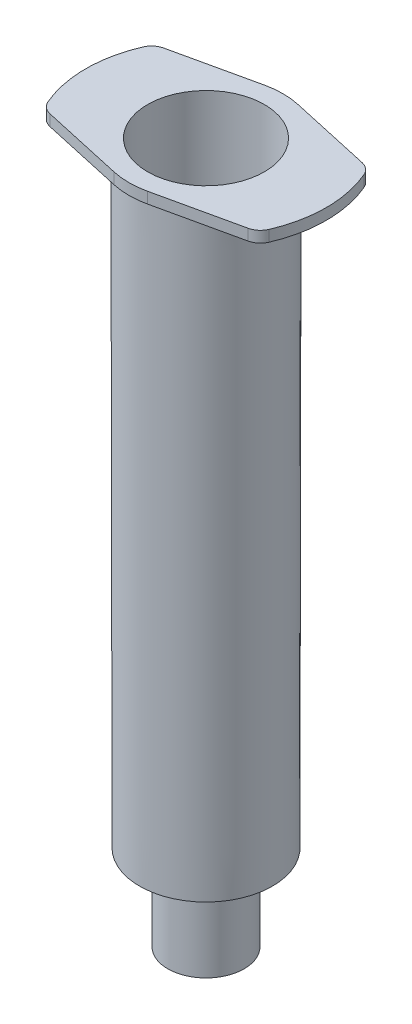
from build123d import *

# Parameters (mm, degrees)
BOSS_EXTRUDE2_DEPTH = 1.37
FILLET1_R           = 2
CUT_EXTRUDE1_REACH  = 90.148
SKETCH3_R           = 7.2


with BuildPart() as part:
    # Sketch1 → Revolve1 (revolve)
    with BuildSketch(Plane.XY):
        Polygon((8.3, 86.37), (8.2, 10.576282817), (4.71, 8.87), (4.71, 0), (3.96, 0), (3.96, 4.391129032), (2, 4.391129032), (2, 0), (1, 0), (1, 8.169274748), (7.2, 11.200493506), (7.2, 86.37), align=None)
    revolve(axis=Axis((0, 0, 0), (0, 1, 0)))

    # Sketch2 → Boss-Extrude2 (add)
    with BuildSketch(Plane(origin=(0, 86.37, 0), x_dir=(1, 0, 0), z_dir=(0, 1, 0))):
        with BuildLine():
            Line((2.056176332, 9.274812068), (13.180263935, 6.808661219))
            ThreePointArc((13.180263935, 6.808661219), (14.835, 0), (13.180263935, -6.808661219))
            Line((13.180263935, -6.808661219), (2.056176332, -9.274812068))
            ThreePointArc((2.056176332, -9.274812068), (0, -9.5), (-2.056176332, -9.274812068))
            Line((-2.056176332, -9.274812068), (-13.180263935, -6.808661219))
            ThreePointArc((-13.180263935, -6.808661219), (-14.835, 0), (-13.180263935, 6.808661219))
            Line((-13.180263935, 6.808661219), (-2.056176332, 9.274812068))
            ThreePointArc((-2.056176332, 9.274812068), (0, 9.5), (2.056176332, 9.274812068))
        make_face()
    extrude(amount=-BOSS_EXTRUDE2_DEPTH)

    # Fillet1
    fillet1_edges = [part.edges().sort_by_distance(p)[0] for p in [
        (13.180263935, 85.685, 6.808661219),
        (-13.180263935, 85.685, 6.808661219),
        (-13.180263935, 85.685, -6.808661219),
        (13.180263935, 85.685, -6.808661219),
    ]]
    fillet(fillet1_edges, radius=FILLET1_R)

    # Sketch3 → Cut-Extrude1 (cut, up to next)
    with BuildSketch(Plane(origin=(0, 86.37, 0), x_dir=(1, 0, 0), z_dir=(0, 1, 0)), mode=Mode.PRIVATE) as cut_extrude1_sk1:
        Circle(SKETCH3_R)
    cut_extrude1_tool1 = extrude(cut_extrude1_sk1.sketch, amount=-CUT_EXTRUDE1_REACH, mode=Mode.PRIVATE) & part.part
    add(cut_extrude1_tool1.solids().sort_by_distance((0, 86.37, 0))[0], mode=Mode.SUBTRACT)


solid = part.part
